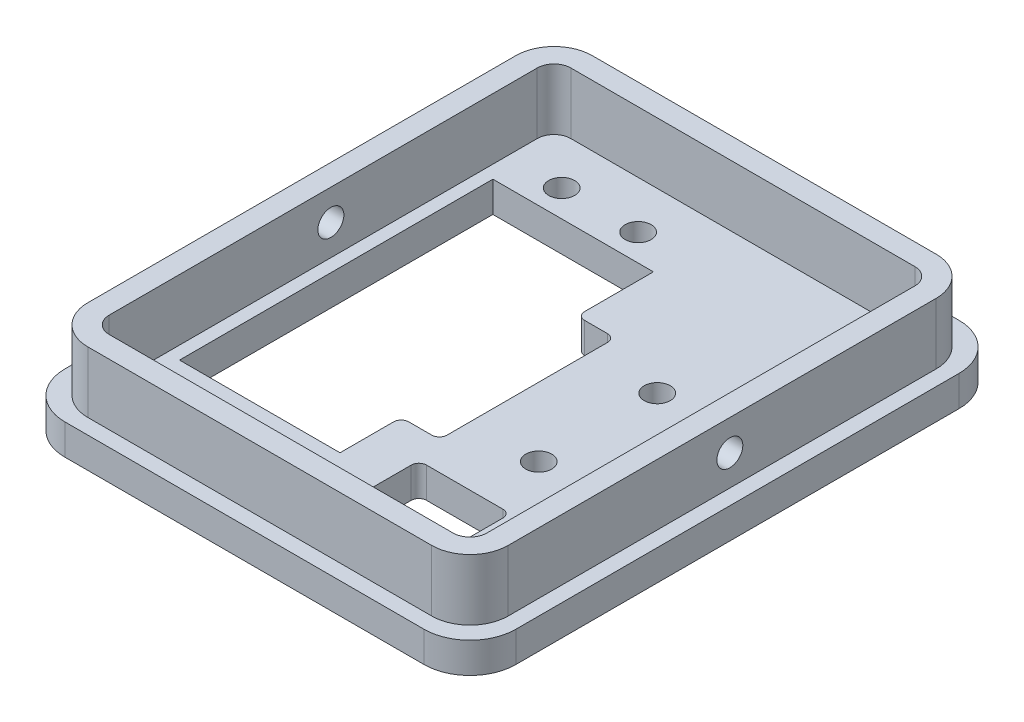
from build123d import *

# Parameters (mm, degrees)
SKETCH2_R           = 1.699999062
SKETCH2_R_2         = 1.69999994
BOSS_EXTRUDE1_DEPTH = 4
BOSS_EXTRUDE2_DEPTH = 8
SKETCH4_R           = 1.7
CUT_EXTRUDE1_DEPTH  = 93


# Read off the part's stored shape, not the designer's step: Surface-Imported1
with BuildPart() as part:
    # Sketch2 → Boss-Extrude1 (new body)
    with BuildSketch(Plane(origin=(0, 0, 0), x_dir=(1, 0, 0), z_dir=(0, 1, 0))):
        with BuildLine():
            Line((6.000000983, 0), (52.999999374, 0))
            ThreePointArc((52.999999374, 0), (57.242640757, -1.757359601), (59.000000358, -6.000000983))
            Line((59.000000358, -6.000000983), (59.000000358, -63.999995589))
            ThreePointArc((59.000000358, -63.999995589), (57.242641528, -68.242638834), (52.999999374, -70.000000298))
            Line((52.999999374, -70.000000298), (6.000000983, -70.000000298))
            ThreePointArc((6.000000983, -70.000000298), (1.75735699, -68.242640674), (0, -63.999995589))
            Line((0, -63.999995589), (0, -6.000000983))
            ThreePointArc((0, -6.000000983), (1.757359601, -1.757359601), (6.000000983, 0))
        make_face()
        with Locations(Location((12.000001036, -10.99999994, 0), (0, 0, 270))):
            Circle(SKETCH2_R, mode=Mode.SUBTRACT)
        with Locations(Location((22.000001036, -10.99999994, 0), (0, 0, 270))):
            Circle(SKETCH2_R, mode=Mode.SUBTRACT)
        with Locations(Location((22.000001036, -59.000000715, 0), (0, 0, 270))):
            Circle(SKETCH2_R, mode=Mode.SUBTRACT)
        with Locations(Location((12.000001036, -59.000000715, 0), (0, 0, 270))):
            Circle(SKETCH2_R, mode=Mode.SUBTRACT)
        with Locations(Location((41.50000118, -27.999999899, 0), (0, 0, 270))):
            Circle(SKETCH2_R_2, mode=Mode.SUBTRACT)
        with Locations(Location((41.50000118, -43.499999899, 0), (0, 0, 270))):
            Circle(SKETCH2_R_2, mode=Mode.SUBTRACT)
        with BuildLine():
            Line((32.499998808, -46.500001103), (32.499998808, -25.499999523))
            ThreePointArc((32.499998808, -25.499999523), (32.207106087, -24.792893943), (31.500000507, -24.500001222))
            Line((31.500000507, -24.500001222), (28.500001878, -24.500001222))
            ThreePointArc((28.500001878, -24.500001222), (27.792893663, -24.20710741), (27.499999851, -23.499999195))
            Line((27.499999851, -23.499999195), (27.499999851, -14.499999583))
            Line((27.499999851, -14.499999583), (6.500001065, -14.499999583))
            Line((6.500001065, -14.499999583), (6.500001065, -55.500000715))
            Line((6.500001065, -55.500000715), (27.499999851, -55.500000715))
            Line((27.499999851, -55.500000715), (27.499999851, -48.500001431))
            ThreePointArc((27.499999851, -48.500001431), (27.792894046, -47.792893599), (28.500001878, -47.499999404))
            Line((28.500001878, -47.499999404), (31.500000507, -47.499999404))
            ThreePointArc((31.500000507, -47.499999404), (32.207106087, -47.207106683), (32.499998808, -46.500001103))
        make_face(mode=Mode.SUBTRACT)
        with BuildLine():
            Line((34.55240652, -51.235973835), (44.55240652, -51.235973835))
            ThreePointArc((44.55240652, -51.235973835), (45.259513765, -51.528867517), (45.55240652, -52.235975146))
            Line((45.55240652, -52.235975146), (45.55240652, -58.235975146))
            ThreePointArc((45.55240652, -58.235975146), (45.259513301, -58.943081927), (44.55240652, -59.235975146))
            Line((44.55240652, -59.235975146), (34.55240652, -59.235975146))
            ThreePointArc((34.55240652, -59.235975146), (33.845298305, -58.943081334), (33.552404493, -58.23597312))
            Line((33.552404493, -58.23597312), (33.552404493, -52.235975862))
            ThreePointArc((33.552404493, -52.235975862), (33.845297712, -51.528867054), (34.55240652, -51.235973835))
        make_face(mode=Mode.SUBTRACT)
    extrude(amount=BOSS_EXTRUDE1_DEPTH)

    # Sketch3 → Boss-Extrude2 (add)
    with BuildSketch(Plane(origin=(0, 4, 0), x_dir=(1, 0, 0), z_dir=(0, 1, 0))):
        with BuildLine():
            Line((2, -7), (2, -63.000000298))
            ThreePointArc((2, -63.000000298), (3.464466094, -66.535534204), (7, -68.000000298))
            Line((7, -68.000000298), (52.000000358, -68.000000298))
            ThreePointArc((52.000000358, -68.000000298), (55.535534264, -66.535534204), (57.000000358, -63.000000298))
            Line((57.000000358, -63.000000298), (57.000000358, -7))
            ThreePointArc((57.000000358, -7), (55.535534264, -3.464466094), (52.000000358, -2))
            Line((52.000000358, -2), (7, -2))
            ThreePointArc((7, -2), (3.464466094, -3.464466094), (2, -7))
        make_face()
        with BuildLine():
            Line((4.8, -7), (4.8, -63.000000298))
            ThreePointArc((4.8, -63.000000298), (5.444365081, -64.555635217), (7, -65.200000298))
            Line((7, -65.200000298), (52.000000358, -65.200000298))
            ThreePointArc((52.000000358, -65.200000298), (53.555635276, -64.555635217), (54.200000358, -63.000000298))
            Line((54.200000358, -63.000000298), (54.200000358, -7))
            ThreePointArc((54.200000358, -7), (53.555635276, -5.444365081), (52.000000358, -4.8))
            Line((52.000000358, -4.8), (7, -4.8))
            ThreePointArc((7, -4.8), (5.444365081, -5.444365081), (4.8, -7))
        make_face(mode=Mode.SUBTRACT)
    extrude(amount=BOSS_EXTRUDE2_DEPTH)

    # Sketch4 → Cut-Extrude1 (cut)
    with BuildSketch(Plane(origin=(57.000000358, 0, 0), x_dir=(0, 0, -1), z_dir=(1, 0, 0))):
        with Locations((-34.000000298, 8)):
            Circle(SKETCH4_R)
    extrude(amount=-CUT_EXTRUDE1_DEPTH, mode=Mode.SUBTRACT)


solid = part.part
